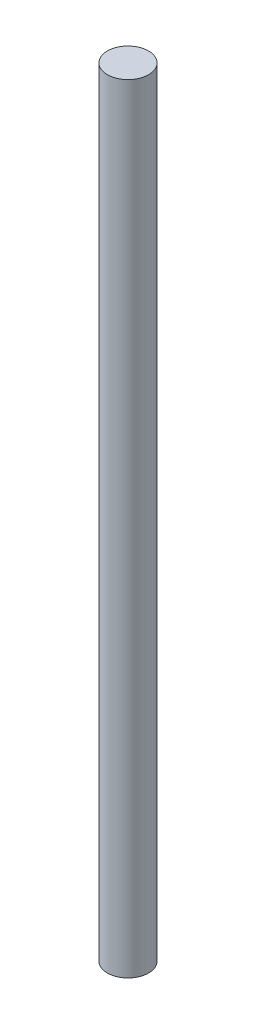
from build123d import *

# Parameters (mm, degrees)
SKETCH1_R           = 6.35
BOSS_EXTRUDE1_DEPTH = 120


with BuildPart() as part:
    # Sketch1 → Boss-Extrude1 (new, symmetric)
    with BuildSketch(Plane(origin=(0, 0, 0), x_dir=(1, 0, 0), z_dir=(0, 1, 0))):
        Circle(SKETCH1_R)
    extrude(amount=BOSS_EXTRUDE1_DEPTH, both=True)


solid = part.part
